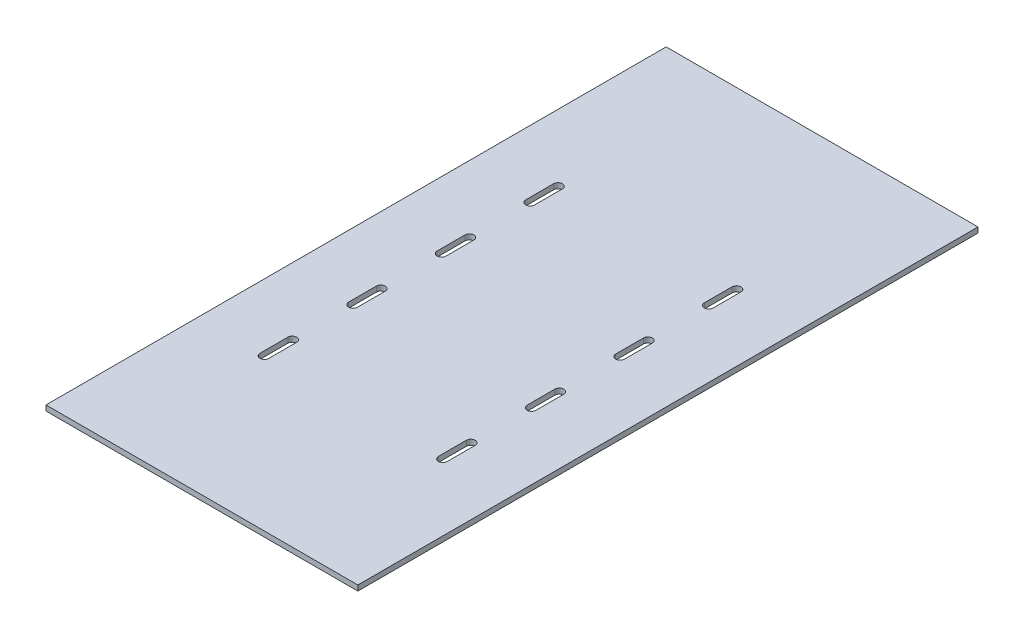
from build123d import *

# Parameters (mm, degrees)
SKETCH1_W                 = 176
SKETCH1_H                 = 350
BOSS_EXTRUDE1_DEPTH       = 3
F_5_0MM_DOWEL_SLOT1_DEPTH = 3


# Read off the part's stored shape, not the designer's step: Ø5.0mm Dowel Slot1
with BuildPart() as part:
    # Sketch1 → Boss-Extrude1 (new body)
    with BuildSketch(Plane(origin=(0, 0, 0), x_dir=(1, 0, 0), z_dir=(0, 1, 0))):
        with Locations((88, 175)):
            Rectangle(SKETCH1_W, SKETCH1_H)
    extrude(amount=BOSS_EXTRUDE1_DEPTH)

    # Ø5.0mm Dowel Slot1 outline → Ø5.0mm Dowel Slot1 (cut)
    with BuildSketch(Plane(origin=(0, 0, 0), x_dir=(1, 0, 0), z_dir=(0, 1, 0))):
        with BuildLine():
            Line((35.125, 251.35), (35.125, 235.65))
            ThreePointArc((35.125, 235.65), (37.625, 233.15), (40.125, 235.65))
            Line((40.125, 235.65), (40.125, 251.35))
            ThreePointArc((40.125, 251.35), (37.625, 253.85), (35.125, 251.35))
        make_face()
        with BuildLine():
            Line((40.125, 185.65), (40.125, 201.35))
            ThreePointArc((40.125, 201.35), (37.625, 203.85), (35.125, 201.35))
            Line((35.125, 201.35), (35.125, 185.65))
            ThreePointArc((35.125, 185.65), (37.625, 183.15), (40.125, 185.65))
        make_face()
        with BuildLine():
            Line((40.125, 135.65), (40.125, 151.35))
            ThreePointArc((40.125, 151.35), (37.625, 153.85), (35.125, 151.35))
            Line((35.125, 151.35), (35.125, 135.65))
            ThreePointArc((35.125, 135.65), (37.625, 133.15), (40.125, 135.65))
        make_face()
        with BuildLine():
            Line((40.125, 85.65), (40.125, 101.35))
            ThreePointArc((40.125, 101.35), (37.625, 103.85), (35.125, 101.35))
            Line((35.125, 101.35), (35.125, 85.65))
            ThreePointArc((35.125, 85.65), (37.625, 83.15), (40.125, 85.65))
        make_face()
        with BuildLine():
            Line((135.875, 251.35), (135.875, 235.65))
            ThreePointArc((135.875, 235.65), (138.375, 233.15), (140.875, 235.65))
            Line((140.875, 235.65), (140.875, 251.35))
            ThreePointArc((140.875, 251.35), (138.375, 253.85), (135.875, 251.35))
        make_face()
        with BuildLine():
            Line((140.875, 185.65), (140.875, 201.35))
            ThreePointArc((140.875, 201.35), (138.375, 203.85), (135.875, 201.35))
            Line((135.875, 201.35), (135.875, 185.65))
            ThreePointArc((135.875, 185.65), (138.375, 183.15), (140.875, 185.65))
        make_face()
        with BuildLine():
            Line((140.875, 135.65), (140.875, 151.35))
            ThreePointArc((140.875, 151.35), (138.375, 153.85), (135.875, 151.35))
            Line((135.875, 151.35), (135.875, 135.65))
            ThreePointArc((135.875, 135.65), (138.375, 133.15), (140.875, 135.65))
        make_face()
        with BuildLine():
            Line((140.875, 85.65), (140.875, 101.35))
            ThreePointArc((140.875, 101.35), (138.375, 103.85), (135.875, 101.35))
            Line((135.875, 101.35), (135.875, 85.65))
            ThreePointArc((135.875, 85.65), (138.375, 83.15), (140.875, 85.65))
        make_face()
    extrude(amount=F_5_0MM_DOWEL_SLOT1_DEPTH, mode=Mode.SUBTRACT)


solid = part.part
